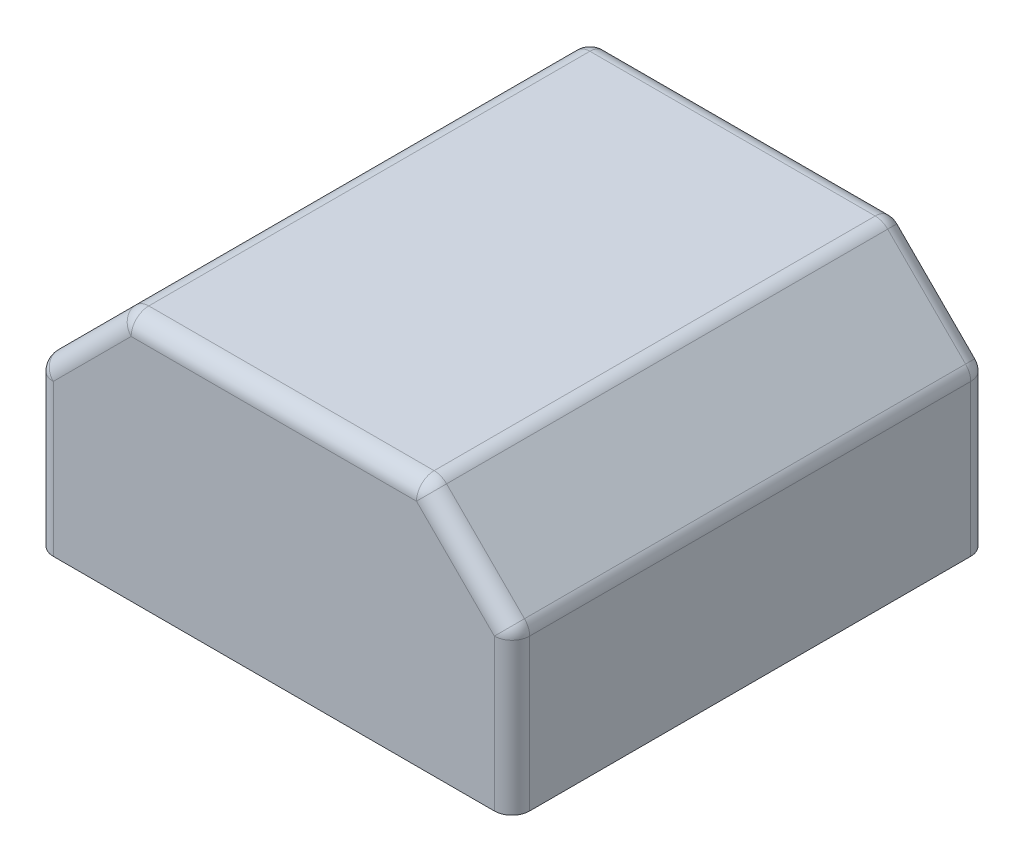
from build123d import *

# Parameters (mm, degrees)
SKETCH1_W           = 13.5
SKETCH1_H           = 13.5
BOSS_EXTRUDE1_DEPTH = 5
SKETCH3_W           = 13.5
SKETCH3_H           = 13.5
BOSS_EXTRUDE2_DEPTH = 2
CHAMFER1_SIZE       = 2.5
FILLET2_R           = 0.5
FILLET1_R           = 0.5


with BuildPart() as part:
    # Sketch1 → Boss-Extrude1 (new body)
    with BuildSketch(Plane(origin=(0, 0, 0), x_dir=(1, 0, 0), z_dir=(0, 1, 0))):
        Rectangle(SKETCH1_W, SKETCH1_H)
        Polygon((0, -5.715767665), (4.95, -2.857883832), (4.95, 2.857883832), (0, 5.715767665), (-4.95, 2.857883832), (-4.95, -2.857883832), align=None, mode=Mode.SUBTRACT)
    extrude(amount=BOSS_EXTRUDE1_DEPTH)

    # Sketch3 → Boss-Extrude2 (add)
    with BuildSketch(Plane(origin=(0, 5, 0), x_dir=(1, 0, 0), z_dir=(0, 1, 0))):
        Rectangle(SKETCH3_W, SKETCH3_H)
    extrude(amount=BOSS_EXTRUDE2_DEPTH)

    # Chamfer1
    chamfer1_edges = [part.edges().sort_by_distance(p)[0] for p in [
        (6.75, 7, 0),
        (-6.75, 7, 0),
    ]]
    chamfer(chamfer1_edges, length=CHAMFER1_SIZE)

    # Fillet2
    fillet2_edges = [part.edges().sort_by_distance(p)[0] for p in [
        (-4.95, 2.5, -2.857883832),
        (-4.95, 2.5, 2.857883832),
        (0, 2.5, 5.715767665),
        (4.95, 2.5, 2.857883832),
        (4.95, 2.5, -2.857883832),
        (0, 2.5, -5.715767665),
    ]]
    fillet(fillet2_edges, radius=FILLET2_R)

    # Fillet1
    fillet1_edges = [part.edges().sort_by_distance(p)[0] for p in [
        (-6.75, 2.25, -6.75),
        (-6.75, 2.25, 6.75),
        (6.75, 2.25, -6.75),
        (6.75, 2.25, 6.75),
        (-5.5, 5.75, -6.75),
        (0, 7, -6.75),
        (5.5, 5.75, -6.75),
        (5.5, 5.75, 6.75),
        (0, 7, 6.75),
        (-5.5, 5.75, 6.75),
        (6.75, 4.5, 0),
        (4.25, 7, 0),
        (-4.25, 7, 0),
        (-6.75, 4.5, 0),
    ]]
    fillet(fillet1_edges, radius=FILLET1_R)


solid = part.part
